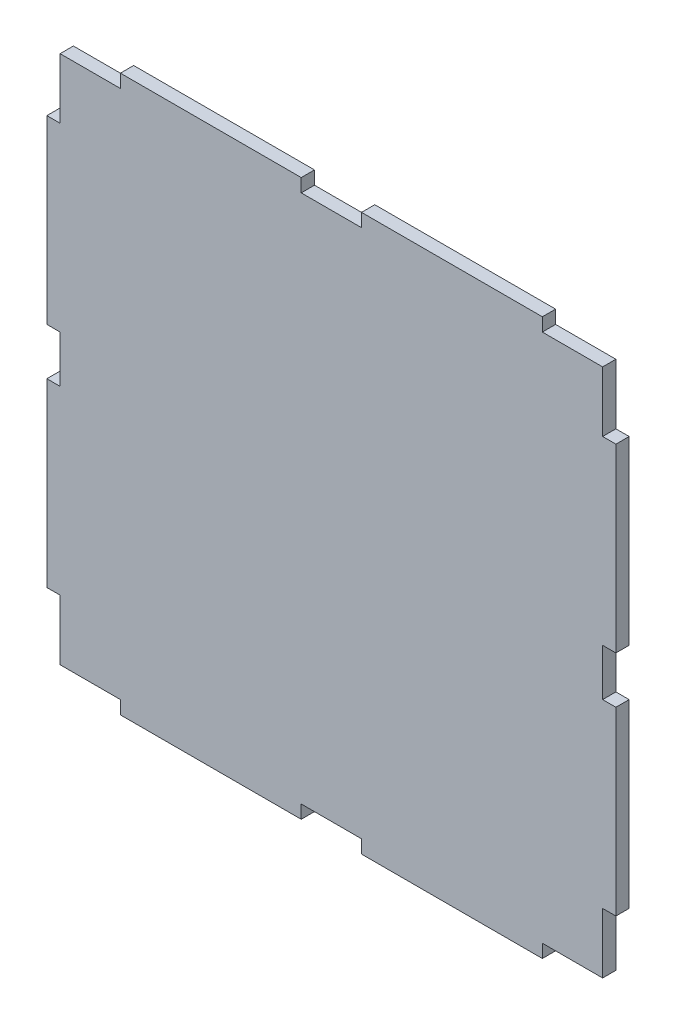
from build123d import *

# Parameters (mm, degrees)
BOSS_EXTRUDE1_DEPTH = 5.588


with BuildPart() as part:
    # Sketch5 → Boss-Extrude1 (new body)
    with BuildSketch(Plane.XY):
        Polygon((170.712770275, -168.516401611), (145.312770275, -168.516401611), (145.312770275, -193.916401611), (139.724770275, -193.916401611), (139.724770275, -270.116401611), (145.312770275, -270.116401611), (145.312770275, -289.928401611), (139.724770275, -289.928401611), (139.724770275, -366.128401611), (145.312770275, -366.128401611), (145.312770275, -391.528401611), (170.712770275, -391.528401611), (170.712770275, -397.116401611), (246.912770275, -397.116401611), (246.912770275, -391.528401611), (272.312770275, -391.528401611), (272.312770275, -397.116401611), (348.512770275, -397.116401611), (348.512770275, -391.528401611), (373.912770275, -391.528401611), (373.912770275, -366.128401611), (379.500770275, -366.128401611), (379.500770275, -289.928401611), (373.912770275, -289.928401611), (373.912770275, -270.116401611), (379.500770275, -270.116401611), (379.500770275, -193.916401611), (373.912770275, -193.916401611), (373.912770275, -168.516401611), (348.512770275, -168.516401611), (348.512770275, -162.928401611), (272.312770275, -162.928401611), (272.312770275, -168.516401611), (246.912770275, -168.516401611), (246.912770275, -162.928401611), (170.712770275, -162.928401611), align=None)
    extrude(amount=BOSS_EXTRUDE1_DEPTH)


solid = part.part
